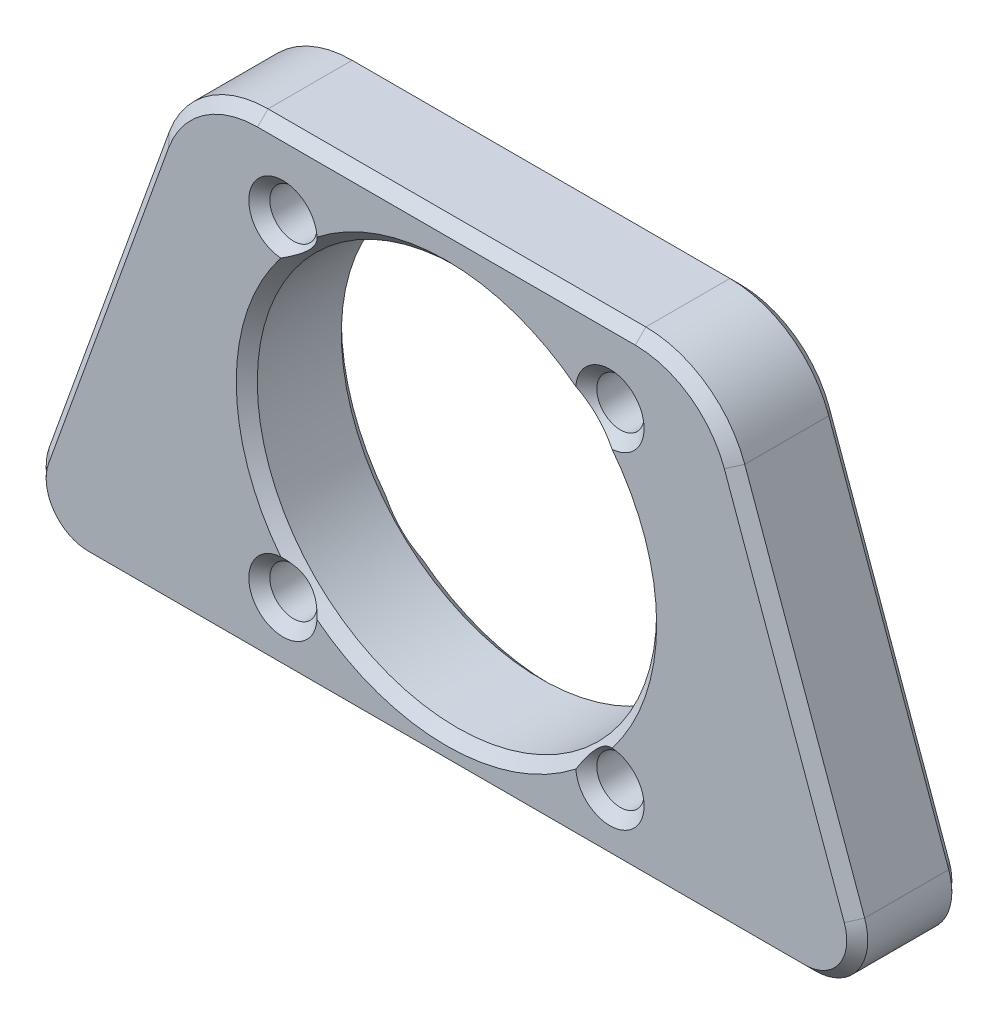
from build123d import *

# Parameters (mm, degrees)
SKETCH1_R           = 19
SKETCH1_R_2         = 2.25
BOSS_EXTRUDE1_DEPTH = 10
CHAMFER1_SIZE       = 1


with BuildPart() as part:
    # Sketch1 → Boss-Extrude1 (new body)
    with BuildSketch(Plane.XY):
        with BuildLine():
            Line((-27.380609914, 122.387194683), (-38.790304957, 90.693597341))
            ThreePointArc((-38.790304957, 90.693597341), (-38.176588293, 86.124933627), (-34.085867898, 84))
            Line((-34.085867898, 84), (-15.12911101, 84))
            Line((-15.12911101, 84), (15.12911101, 84))
            Line((15.12911101, 84), (34.085867898, 84))
            ThreePointArc((34.085867898, 84), (38.176588293, 86.124933627), (38.790304957, 90.693597341))
            Line((38.790304957, 90.693597341), (27.380609914, 122.387194683))
            ThreePointArc((27.380609914, 122.387194683), (23.721868541, 127.181440791), (17.971735796, 129))
            Line((17.971735796, 129), (-17.971735796, 129))
            ThreePointArc((-17.971735796, 129), (-23.721868541, 127.181440791), (-27.380609914, 122.387194683))
        make_face()
        with Locations(Location((0, 106, 0), (0, 0, 270))):
            Circle(SKETCH1_R, mode=Mode.SUBTRACT)
        with Locations(Location((15.556349182, 90.443650818, 0), (0, 0, 270))):
            Circle(SKETCH1_R_2, mode=Mode.SUBTRACT)
        with Locations(Location((-15.556349182, 90.443650818, 0), (0, 0, 270))):
            Circle(SKETCH1_R_2, mode=Mode.SUBTRACT)
        with Locations(Location((15.556349182, 121.556349182, 0), (0, 0, 270))):
            Circle(SKETCH1_R_2, mode=Mode.SUBTRACT)
        with Locations(Location((-15.556349182, 121.556349182, 0), (0, 0, 270))):
            Circle(SKETCH1_R_2, mode=Mode.SUBTRACT)
    extrude(amount=BOSS_EXTRUDE1_DEPTH)

    # Chamfer1
    # the kernel refuses this chamfer: 1 mm, written as the material it takes off along each edge
    with BuildSketch(Plane(origin=(17.971735796, 129, 0), x_dir=(0, 0.027495876610582174, 0.9996219169112968), z_dir=(-1, 0, 0)), Plane(origin=(17.971735796, 129, 10), x_dir=(0, -0.9996219169112968, 0.02749587661058574), z_dir=(-1, 0, 0))) as chamfer1_piece_1:
        Polygon((CHAMFER1_SIZE * 0.999621916911, -CHAMFER1_SIZE * 0.0274958766106), (-CHAMFER1_SIZE * 0.0274958766106, -CHAMFER1_SIZE * 0.999621916911), (0, 0), align=None)
    extrude(amount=35.943471591, mode=Mode.SUBTRACT)
    with BuildSketch(Plane(origin=(17.971735796, 119, 0), x_dir=(0.9408874118687268, 0.33871946827274174, 0), z_dir=(0.33871946827274174, -0.9408874118687268, 0))) as chamfer1_piece_2:
        Polygon((10, CHAMFER1_SIZE), (10 - CHAMFER1_SIZE, 0), (10, 0), align=None)
    revolve(axis=Axis((17.971735796, 119, 0), (0, 0, 1)), revolution_arc=70.201123645, mode=Mode.SUBTRACT)
    with BuildSketch(Plane(origin=(38.790304957, 90.693597341, 0), x_dir=(0.025870524181196484, 0.009313388705230746, 0.9996219169112968), z_dir=(-0.3387194682727421, 0.9408874118687267, 0)), Plane(origin=(-27.380609914, 122.387194683, 0), x_dir=(-0.025870524181196484, 0.00931338870523073, 0.9996219169112968), z_dir=(-0.3387194682727416, -0.9408874118687268, 0)), Plane(origin=(38.790304957, 90.693597341, 10), x_dir=(-0.9405316782499255, -0.33859140416997363, 0.027495876610585557), z_dir=(-0.3387194682727421, 0.9408874118687267, 0))) as chamfer1_piece_3:
        Polygon((CHAMFER1_SIZE * 0.999621916911, -CHAMFER1_SIZE * 0.0274958766106), (-CHAMFER1_SIZE * 0.0274958766106, -CHAMFER1_SIZE * 0.999621916911), (0, 0), align=None)
    extrude(amount=33.684792613, mode=Mode.SUBTRACT)
    with BuildSketch(Plane(origin=(34.085867898, 89, 0), x_dir=(0, -1, 0), z_dir=(-1, 0, 0))) as chamfer1_piece_4:
        Polygon((5, CHAMFER1_SIZE), (5 - CHAMFER1_SIZE, 0), (5, 0), align=None)
    revolve(axis=Axis((34.085867898, 89, 0), (0, 0, 1)), revolution_arc=109.798876355, mode=Mode.SUBTRACT)
    with BuildSketch(Plane(origin=(-34.085867898, 84, 0), x_dir=(0, -0.027495876610582174, 0.9996219169112968), z_dir=(1, 0, 0))) as chamfer1_piece_5:
        Polygon((CHAMFER1_SIZE * 0.999621916911, -CHAMFER1_SIZE * 0.0274958766106), (-CHAMFER1_SIZE * 0.0274958766106, -CHAMFER1_SIZE * 0.999621916911), (0, 0), align=None)
    extrude(amount=68.171735796, mode=Mode.SUBTRACT)
    with BuildSketch(Plane(origin=(-34.085867898, 89, 0), x_dir=(-0.9408874118687287, 0.33871946827273663, 0), z_dir=(0.33871946827273663, 0.9408874118687287, 0))) as chamfer1_piece_6:
        Polygon((5 - CHAMFER1_SIZE, 0), (5, CHAMFER1_SIZE), (5, 0), align=None)
    revolve(axis=Axis((-34.085867898, 89, 0), (0, 0, 1)), revolution_arc=109.798876355, mode=Mode.SUBTRACT)
    with BuildSketch(Plane(origin=(-17.971735796, 119, 0), x_dir=(0, 1, 0), z_dir=(1, 0, 0))) as chamfer1_piece_7:
        Polygon((10 - CHAMFER1_SIZE, 0), (10, CHAMFER1_SIZE), (10, 0), align=None)
    revolve(axis=Axis((-17.971735796, 119, 0), (0, 0, 1)), revolution_arc=70.201123645, mode=Mode.SUBTRACT)
    with BuildSketch(Plane(origin=(0, 106, 0), x_dir=(0, -1, 0), z_dir=(-1, 0, 0))) as chamfer1_piece_8:
        Polygon((19, CHAMFER1_SIZE), (19 + CHAMFER1_SIZE, 0), (19, 0), align=None)
    revolve(axis=Axis((0, 106, 0), (0, 0, 1)), mode=Mode.SUBTRACT)
    with BuildSketch(Plane(origin=(15.556349182, 90.443650818, 0), x_dir=(0, -1, 0), z_dir=(-1, 0, 0))) as chamfer1_piece_9:
        Polygon((2.25, CHAMFER1_SIZE), (2.25 + CHAMFER1_SIZE, 0), (2.25, 0), align=None)
    revolve(axis=Axis((15.556349182, 90.443650818, 0), (0, 0, 1)), mode=Mode.SUBTRACT)
    with BuildSketch(Plane(origin=(-15.556349182, 90.443650818, 0), x_dir=(0, -1, 0), z_dir=(-1, 0, 0))) as chamfer1_piece_10:
        Polygon((2.25, CHAMFER1_SIZE), (2.25 + CHAMFER1_SIZE, 0), (2.25, 0), align=None)
    revolve(axis=Axis((-15.556349182, 90.443650818, 0), (0, 0, 1)), mode=Mode.SUBTRACT)
    with BuildSketch(Plane(origin=(15.556349182, 121.556349182, 0), x_dir=(0, -1, 0), z_dir=(-1, 0, 0))) as chamfer1_piece_11:
        Polygon((2.25, CHAMFER1_SIZE), (2.25 + CHAMFER1_SIZE, 0), (2.25, 0), align=None)
    revolve(axis=Axis((15.556349182, 121.556349182, 0), (0, 0, 1)), mode=Mode.SUBTRACT)
    with BuildSketch(Plane(origin=(-15.556349182, 121.556349182, 0), x_dir=(0, -1, 0), z_dir=(-1, 0, 0))) as chamfer1_piece_12:
        Polygon((2.25, CHAMFER1_SIZE), (2.25 + CHAMFER1_SIZE, 0), (2.25, 0), align=None)
    revolve(axis=Axis((-15.556349182, 121.556349182, 0), (0, 0, 1)), mode=Mode.SUBTRACT)
    with BuildSketch(Plane(origin=(-17.971735796, 119, 10), x_dir=(0, 1, 0), z_dir=(1, 0, 0))) as chamfer1_piece_13:
        Polygon((10 - CHAMFER1_SIZE, 0), (10, -CHAMFER1_SIZE), (10, 0), align=None)
    revolve(axis=Axis((-17.971735796, 119, 10), (0, 0, 1)), revolution_arc=70.201123645, mode=Mode.SUBTRACT)
    with BuildSketch(Plane(origin=(-27.380609914, 122.387194683, 10), x_dir=(-0.025870524181196505, 0.009313388705230739, -0.9996219169112968), z_dir=(-0.3387194682727416, -0.9408874118687268, 0))) as chamfer1_piece_14:
        Polygon((CHAMFER1_SIZE * 0.999621916911, CHAMFER1_SIZE * 0.0274958766106), (-CHAMFER1_SIZE * 0.0274958766106, CHAMFER1_SIZE * 0.999621916911), (0, 0), align=None)
    extrude(amount=33.684792613, mode=Mode.SUBTRACT)
    with BuildSketch(Plane(origin=(-34.085867898, 89, 10), x_dir=(-0.9408874118687287, 0.33871946827273663, 0), z_dir=(0.33871946827273663, 0.9408874118687287, 0))) as chamfer1_piece_15:
        Polygon((5 - CHAMFER1_SIZE, 0), (5, -CHAMFER1_SIZE), (5, 0), align=None)
    revolve(axis=Axis((-34.085867898, 89, 10), (0, 0, 1)), revolution_arc=109.798876355, mode=Mode.SUBTRACT)
    with BuildSketch(Plane(origin=(34.085867898, 84, 10), x_dir=(0, 0.9996219169112968, 0.02749587661058574), z_dir=(-1, 0, 0))) as chamfer1_piece_16:
        Polygon((CHAMFER1_SIZE * 0.999621916911, CHAMFER1_SIZE * 0.0274958766106), (-CHAMFER1_SIZE * 0.0274958766106, CHAMFER1_SIZE * 0.999621916911), (0, 0), align=None)
    extrude(amount=68.171735796, mode=Mode.SUBTRACT)
    with BuildSketch(Plane(origin=(34.085867898, 89, 10), x_dir=(0, -1, 0), z_dir=(-1, 0, 0))) as chamfer1_piece_17:
        Polygon((5 - CHAMFER1_SIZE, 0), (5, -CHAMFER1_SIZE), (5, 0), align=None)
    revolve(axis=Axis((34.085867898, 89, 10), (0, 0, 1)), revolution_arc=109.798876355, mode=Mode.SUBTRACT)
    with BuildSketch(Plane(origin=(17.971735796, 119, 10), x_dir=(0.9408874118687268, 0.33871946827274174, 0), z_dir=(0.33871946827274174, -0.9408874118687268, 0))) as chamfer1_piece_18:
        Polygon((10 - CHAMFER1_SIZE, 0), (10, -CHAMFER1_SIZE), (10, 0), align=None)
    revolve(axis=Axis((17.971735796, 119, 10), (0, 0, 1)), revolution_arc=70.201123645, mode=Mode.SUBTRACT)
    with BuildSketch(Plane(origin=(0, 106, 10), x_dir=(0, -1, 0), z_dir=(-1, 0, 0))) as chamfer1_piece_19:
        Polygon((19 + CHAMFER1_SIZE, 0), (19, -CHAMFER1_SIZE), (19, 0), align=None)
    revolve(axis=Axis((0, 106, 10), (0, 0, 1)), mode=Mode.SUBTRACT)
    with BuildSketch(Plane(origin=(15.556349182, 90.443650818, 10), x_dir=(0, -1, 0), z_dir=(-1, 0, 0))) as chamfer1_piece_20:
        Polygon((2.25 + CHAMFER1_SIZE, 0), (2.25, -CHAMFER1_SIZE), (2.25, 0), align=None)
    revolve(axis=Axis((15.556349182, 90.443650818, 10), (0, 0, 1)), mode=Mode.SUBTRACT)
    with BuildSketch(Plane(origin=(-15.556349182, 90.443650818, 10), x_dir=(0, -1, 0), z_dir=(-1, 0, 0))) as chamfer1_piece_21:
        Polygon((2.25 + CHAMFER1_SIZE, 0), (2.25, -CHAMFER1_SIZE), (2.25, 0), align=None)
    revolve(axis=Axis((-15.556349182, 90.443650818, 10), (0, 0, 1)), mode=Mode.SUBTRACT)
    with BuildSketch(Plane(origin=(15.556349182, 121.556349182, 10), x_dir=(0, -1, 0), z_dir=(-1, 0, 0))) as chamfer1_piece_22:
        Polygon((2.25 + CHAMFER1_SIZE, 0), (2.25, -CHAMFER1_SIZE), (2.25, 0), align=None)
    revolve(axis=Axis((15.556349182, 121.556349182, 10), (0, 0, 1)), mode=Mode.SUBTRACT)
    with BuildSketch(Plane(origin=(-15.556349182, 121.556349182, 10), x_dir=(0, -1, 0), z_dir=(-1, 0, 0))) as chamfer1_piece_23:
        Polygon((2.25 + CHAMFER1_SIZE, 0), (2.25, -CHAMFER1_SIZE), (2.25, 0), align=None)
    revolve(axis=Axis((-15.556349182, 121.556349182, 10), (0, 0, 1)), mode=Mode.SUBTRACT)


solid = part.part
